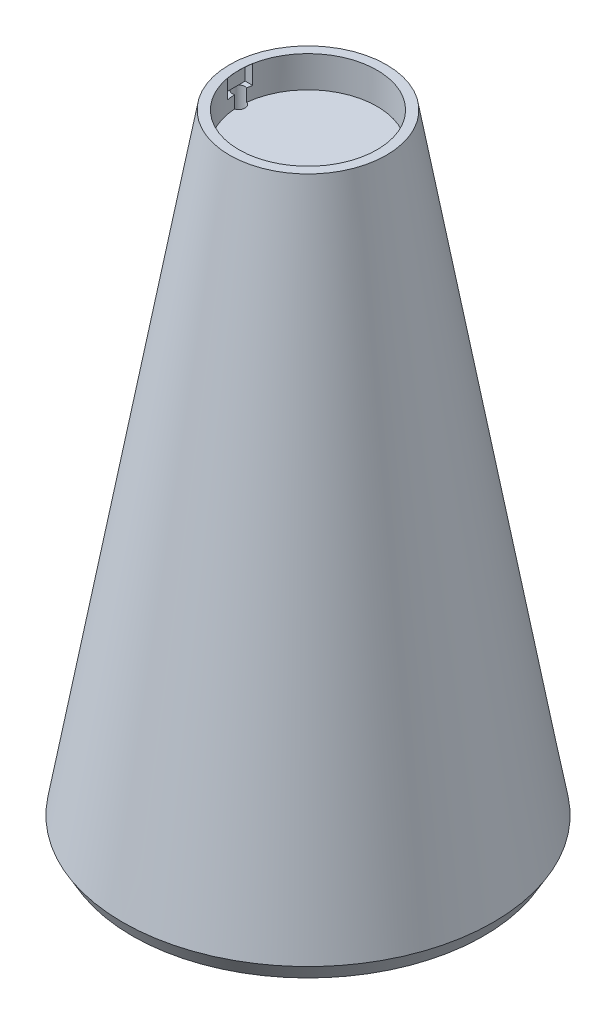
from build123d import *

# Parameters (mm, degrees)
SKETCH2_R          = 12.5
SKETCH1_R          = 30
SKETCH5_R          = 11
CUT_EXTRUDE2_DEPTH = 5
SKETCH7_W          = 4
SKETCH7_H          = 3
CUT_EXTRUDE4_DEPTH = 12
SKETCH8_R          = 1
CUT_EXTRUDE6_DEPTH = 106.854123131
CHAMFER1_SIZE      = 2
CHAMFER1_SIZE2     = 2.698735062


# Read off the part's stored shape, not the designer's step: Shell2
with BuildPart() as part:
    # Sketch2 → Loft1 section 0
    with BuildSketch(Plane(origin=(0, 100, 0), x_dir=(1, 0, 0), z_dir=(0, 1, 0))):
        Circle(SKETCH2_R)
    # Sketch1 → Loft1 section 1
    with BuildSketch(Plane(origin=(0, 0, 0), x_dir=(1, 0, 0), z_dir=(0, 1, 0))):
        Circle(SKETCH1_R)
    loft()

    # Sketch5 → Cut-Extrude2 (cut)
    with BuildSketch(Plane(origin=(0, 100, 0), x_dir=(1, 0, 0), z_dir=(0, 1, 0))):
        with Locations(Location((0, 0, 0), (0, 0, 270))):
            Circle(SKETCH5_R)
    extrude(amount=-CUT_EXTRUDE2_DEPTH, mode=Mode.SUBTRACT)

    # Sketch7 → Cut-Extrude4 (cut)
    with BuildSketch(Plane(origin=(0, 0, 0), x_dir=(0, 0, -1), z_dir=(1, 0, 0))):
        with Locations((-0.000948901, 98.479870862)):
            Rectangle(SKETCH7_W, SKETCH7_H)
    extrude(amount=-CUT_EXTRUDE4_DEPTH, mode=Mode.SUBTRACT)

    # Shell2 outline → Shell2 (revolve, cut)
    with BuildSketch(Plane.XY):
        Polygon((11.274507437, 92.5), (0, 92.5), (0, 0), (27.462007437, 0), align=None)
    revolve(axis=Axis((0, 0, 0), (0, 1, 0)), mode=Mode.SUBTRACT)

    # Sketch8 → Cut-Extrude6 (cut, through all)
    with BuildSketch(Plane(origin=(0, 96.979870862, 0), x_dir=(1, 0, 0), z_dir=(0, 1, 0))):
        with Locations(Location((-11.275969927, 0.228612613, 0), (0, 0, 271.596209632))):
            Circle(SKETCH8_R)
    extrude(amount=-CUT_EXTRUDE6_DEPTH, mode=Mode.SUBTRACT)

    # Chamfer1
    chamfer1_edges = [part.edges().sort_by_distance(p)[0] for p in [
        (-30, 0, 0),
    ]]
    chamfer1_side = [part.faces().sort_by_distance(p)[0] for p in [
        (-29.151471863, 0, 0),
    ]]
    chamfer(chamfer1_edges, length=CHAMFER1_SIZE, length2=CHAMFER1_SIZE2, reference=chamfer1_side[0])


solid = part.part
